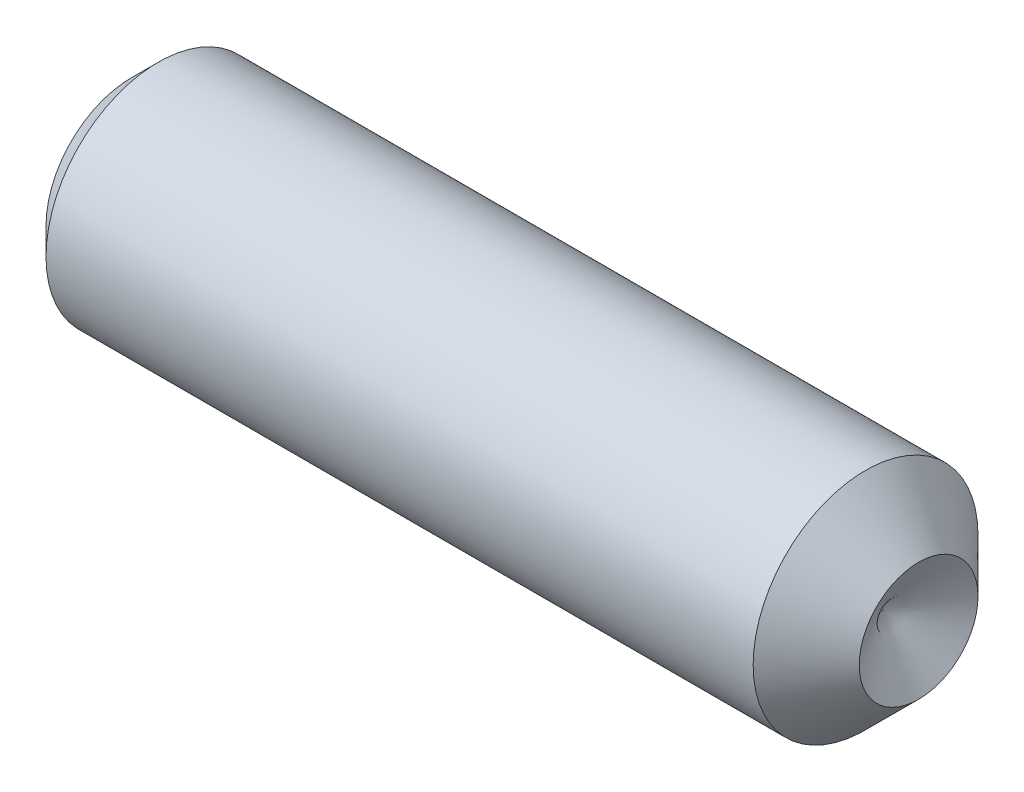
from build123d import *

# Parameters (mm, degrees)
HEX_2_DEPTH = 3.175


with BuildPart() as part:
    # BodySke → BaseBody (revolve)
    with BuildSketch(Plane.XY):
        Polygon((0, 0), (0, 2.41935), (0.75565, 3.175), (20.7264, 3.175), (22.225, 1.6764), (21.217717258, 0), align=None)
    revolve(axis=Axis((-12.7, 0, 0), (1, 0, 0)))

    # Sketch2 → Hex 2 (cut)
    with BuildSketch(Plane.ZY):
        Polygon((0.916543552, 1.5875), (-0.916543552, 1.5875), (-1.833087105, 0), (-0.916543552, -1.5875), (0.916543552, -1.5875), (1.833087105, 0), align=None)
    extrude(amount=-HEX_2_DEPTH, mode=Mode.SUBTRACT)


solid = part.part
